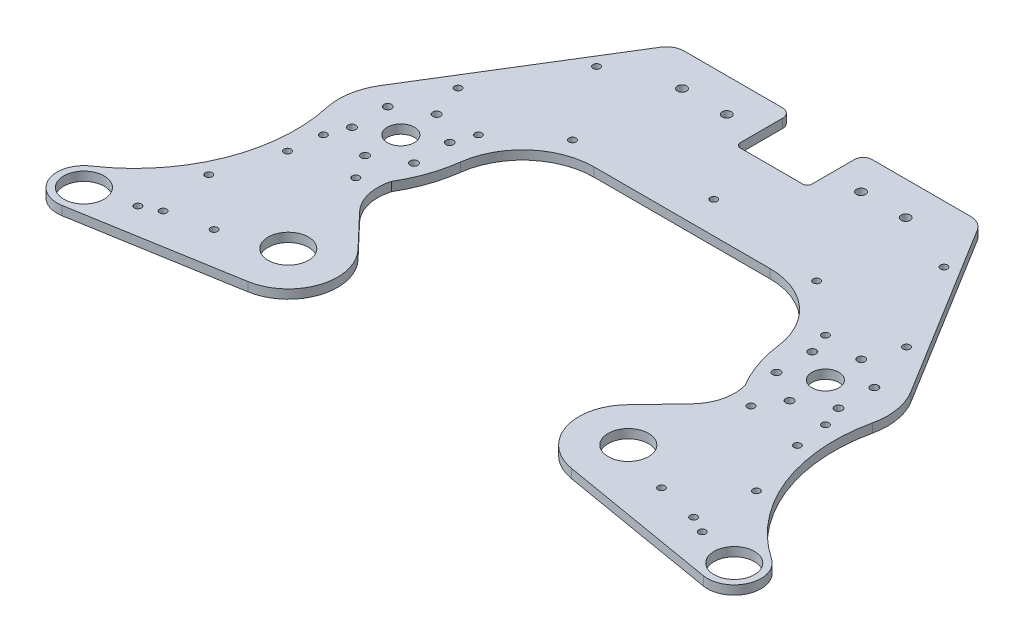
from build123d import *

# Parameters (mm, degrees)
CROQUIS2_R              = 14.3256
SALIENTE_EXTRUIR1_DEPTH = 6.35
CROQUIS2_4_W            = 50.8762
CROQUIS2_4_H            = 39.6875
CROQUIS2_4_R            = 9.5631
CROQUIS2_4_R_2          = 2.75
CORTAR_EXTRUIR1_DEPTH   = 363.005767785
CROQUIS14_R             = 2.4892
CROQUIS14_R_2           = 3.2639
CORTAR_EXTRUIR2_DEPTH   = 363.005767785
REDONDEO1_R             = 6.35
REDONDEO2_R             = 3.175


with BuildPart() as part:
    # Croquis2 → Saliente-Extruir1 (new body)
    with BuildSketch(Plane(origin=(0, 0, 0), x_dir=(1, 0, 0), z_dir=(0, 1, 0))):
        with BuildLine():
            ThreePointArc((-193.697021735, 100.343324363), (-199.141793028, 33.259496154), (-241.393406302, -19.130261599))
            ThreePointArc((-241.393406302, -19.130261599), (-248.427332372, -42.00814192), (-227.545162964, -53.704659555))
            Line((-227.545162964, -53.704659555), (-114.774854846, -34.50123069))
            ThreePointArc((-114.774854846, -34.50123069), (-87.431788835, -11.018289192), (-95.320323823, 24.150771302))
            Line((-95.320323823, 24.150771302), (-117.919425507, 47.853034074))
            ThreePointArc((-117.919425507, 47.853034074), (-125.667640352, 61.991051501), (-125.359085671, 78.110082616))
            ThreePointArc((-125.359085671, 78.110082616), (-117.209880411, 95.622258218), (-112.798586764, 114.427213125))
            ThreePointArc((-112.798586764, 114.427213125), (-95.966139935, 146.092380804), (-62.413214778, 158.75))
            Line((-62.413214778, 158.75), (62.413214778, 158.75))
            ThreePointArc((62.413214778, 158.75), (95.966139935, 146.092380804), (112.798586764, 114.427213125))
            ThreePointArc((112.798586764, 114.427213125), (117.209880411, 95.622258218), (125.359085671, 78.110082616))
            ThreePointArc((125.359085671, 78.110082616), (125.667640352, 61.991051501), (117.919425507, 47.853034074))
            Line((117.919425507, 47.853034074), (95.320323823, 24.150771302))
            ThreePointArc((95.320323823, 24.150771302), (87.431788835, -11.018289192), (114.774854846, -34.50123069))
            Line((114.774854846, -34.50123069), (227.545162964, -53.704659555))
            ThreePointArc((227.545162964, -53.704659555), (248.427332372, -42.00814192), (241.393406302, -19.130261599))
            ThreePointArc((241.393406302, -19.130261599), (199.141793028, 33.259496154), (193.697021735, 100.343324363))
            ThreePointArc((193.697021735, 100.343324363), (194.123492251, 117.215549019), (188.17934046, 133.011779627))
            Line((188.17934046, 133.011779627), (112.410412778, 255.902706341))
            ThreePointArc((112.410412778, 255.902706341), (107.790390919, 260.326641548), (101.6, 261.9375))
            Line((101.6, 261.9375), (-101.6, 261.9375))
            ThreePointArc((-101.6, 261.9375), (-107.790390919, 260.326641548), (-112.410412778, 255.902706341))
            Line((-112.410412778, 255.902706341), (-188.17934046, 133.011779627))
            ThreePointArc((-188.17934046, 133.011779627), (-194.123492251, 117.215549019), (-193.697021735, 100.343324363))
        make_face()
        with Locations((-230.743113403, -34.925)):
            Circle(CROQUIS2_R, mode=Mode.SUBTRACT)
        with Locations((230.743113403, -34.925)):
            Circle(CROQUIS2_R, mode=Mode.SUBTRACT)
        with Locations((120.65, 0)):
            Circle(CROQUIS2_R, mode=Mode.SUBTRACT)
        with Locations((-120.65, 0)):
            Circle(CROQUIS2_R, mode=Mode.SUBTRACT)
    extrude(amount=SALIENTE_EXTRUIR1_DEPTH)

    # Croquis2<4> → Cortar-Extruir1 (cut, through all)
    with BuildSketch(Plane(origin=(0, 0, 0), x_dir=(1, 0, 0), z_dir=(0, 1, 0))):
        with Locations((0, 242.09375)):
            Rectangle(CROQUIS2_4_W, CROQUIS2_4_H)
        with Locations((150.65, 109.872903883)):
            Circle(CROQUIS2_4_R)
        with Locations((-150.65, 135.272903883)):
            Circle(CROQUIS2_4_R_2)
        with Locations((-128.652954744, 122.572903883)):
            Circle(CROQUIS2_4_R_2)
        with Locations((-128.652954744, 97.172903883)):
            Circle(CROQUIS2_4_R_2)
        with Locations((-150.65, 84.472903883)):
            Circle(CROQUIS2_4_R_2)
        with Locations((-172.647045256, 97.172903883)):
            Circle(CROQUIS2_4_R_2)
        with Locations((-172.647045256, 122.572903883)):
            Circle(CROQUIS2_4_R_2)
        with Locations((172.647045256, 122.572903883)):
            Circle(CROQUIS2_4_R_2)
        with Locations((172.647045256, 97.172903883)):
            Circle(CROQUIS2_4_R_2)
        with Locations((150.65, 84.472903883)):
            Circle(CROQUIS2_4_R_2)
        with Locations((128.652954744, 97.172903883)):
            Circle(CROQUIS2_4_R_2)
        with Locations((128.652954744, 122.572903883)):
            Circle(CROQUIS2_4_R_2)
        with Locations((150.65, 135.272903883)):
            Circle(CROQUIS2_4_R_2)
        with Locations((-150.65, 109.872903883)):
            Circle(CROQUIS2_4_R)
    extrude(amount=CORTAR_EXTRUIR1_DEPTH, mode=Mode.SUBTRACT)

    # Croquis14 → Cortar-Extruir2 (cut, through all)
    with BuildSketch(Plane(origin=(0, 6.35, 0), x_dir=(1, 0, 0), z_dir=(0, 1, 0))):
        with Locations((-188.198113403, -21.238686855)):
            Circle(CROQUIS14_R)
        with Locations((-194.31, 17.237923983)):
            Circle(CROQUIS14_R)
        with Locations((-180.900826735, 59.69)):
            Circle(CROQUIS14_R)
        with Locations((-47.625, 238.125)):
            Circle(CROQUIS14_R_2)
        with Locations((-79.375, 238.125)):
            Circle(CROQUIS14_R_2)
        with Locations((-140.226260019, 67.490403883)):
            Circle(CROQUIS14_R)
        with Locations((47.625, 238.125)):
            Circle(CROQUIS14_R_2)
        with Locations((79.375, 238.125)):
            Circle(CROQUIS14_R_2)
        with Locations((0, 181.2925)):
            Circle(CROQUIS14_R)
        with Locations((-86.634838271, 167.64)):
            Circle(CROQUIS14_R)
        with Locations((-159.139503707, 158.938039591)):
            Circle(CROQUIS14_R)
        with Locations((188.198113403, -21.238686855)):
            Circle(CROQUIS14_R)
        with Locations((194.31, 17.237923983)):
            Circle(CROQUIS14_R)
        with Locations((180.900826735, 59.69)):
            Circle(CROQUIS14_R)
        with Locations((140.226260019, 67.490403883)):
            Circle(CROQUIS14_R)
        with Locations((86.634838271, 167.64)):
            Circle(CROQUIS14_R)
        with Locations((159.139503707, 158.938039591)):
            Circle(CROQUIS14_R)
        with Locations((-178.14938272, 82.373521163)):
            Circle(CROQUIS14_R)
        with Locations((-123.15061728, 137.372286604)):
            Circle(CROQUIS14_R)
        with Locations((-123.269261461, 221.351392433)):
            Circle(CROQUIS14_R)
        with Locations((178.14938272, 82.373521163)):
            Circle(CROQUIS14_R)
        with Locations((123.15061728, 137.372286604)):
            Circle(CROQUIS14_R)
        with Locations((123.269261461, 221.351392433)):
            Circle(CROQUIS14_R)
        with Locations((-200.263113403, -27.158057849)):
            Circle(CROQUIS14_R)
        with Locations((-158.75, -14.584491828)):
            Circle(CROQUIS14_R)
        with Locations((158.75, -14.584491828)):
            Circle(CROQUIS14_R)
        with Locations((200.263113403, -27.158057849)):
            Circle(CROQUIS14_R)
    extrude(amount=-CORTAR_EXTRUIR2_DEPTH, mode=Mode.SUBTRACT)

    # Redondeo1
    redondeo1_edges = [part.edges().sort_by_distance(p)[0] for p in [
        (25.4381, 3.175, -261.9375),
        (-25.4381, 3.175, -261.9375),
    ]]
    fillet(redondeo1_edges, radius=REDONDEO1_R)

    # Redondeo2
    redondeo2_edges = [part.edges().sort_by_distance(p)[0] for p in [
        (-25.4381, 3.175, -222.25),
        (25.4381, 3.175, -222.25),
    ]]
    fillet(redondeo2_edges, radius=REDONDEO2_R)


solid = part.part
